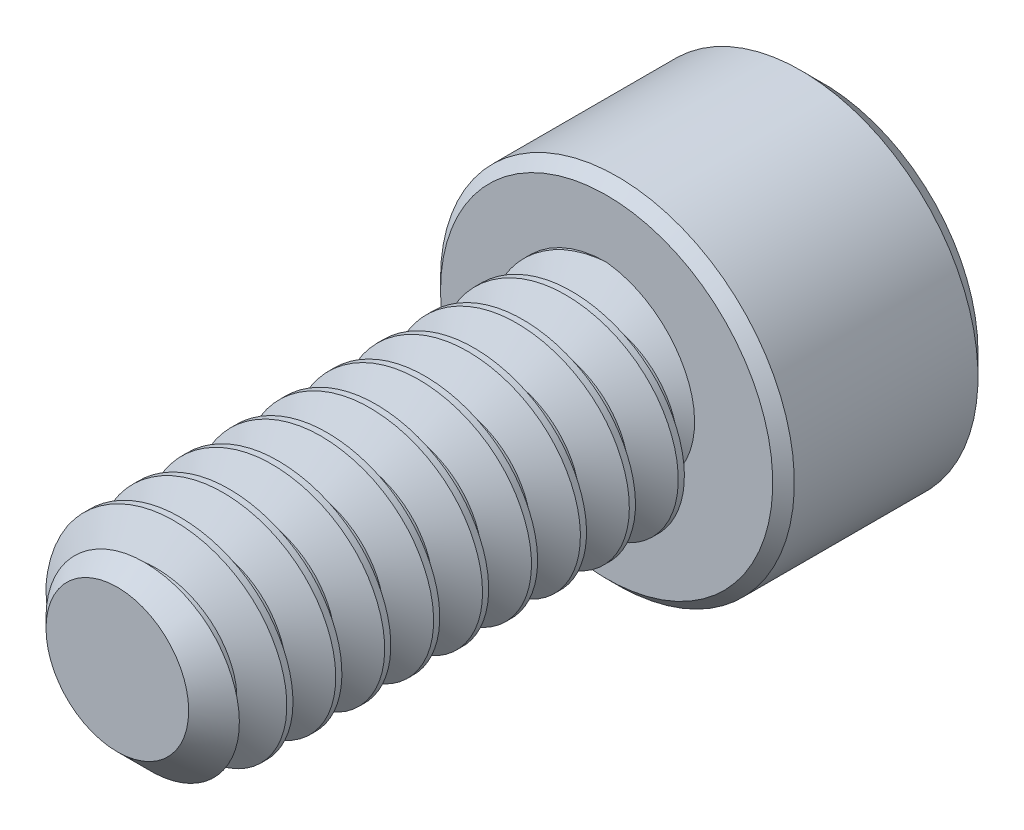
from build123d import *

# Parameters (mm, degrees)
SKETCH1_R          = 1.7526
EXTRUDE1_DEPTH     = 7.9375
CHAMFER3_SIZE      = 0.5953125
CUT_SWEEP1_PITCH   = 0.79375
SKETCH6_R          = 2.8702
EXTRUDE2_DEPTH     = 3.5052
CUT_EXTRUDE1_DEPTH = 2.08359375
SKETCH8_R          = 1.603951217
CUT_EXTRUDE2_DEPTH = 0.35052
CUT_EXTRUDE2_DRAFT = -45
CHAMFER1_SIZE      = 0.35052
CHAMFER2_SIZE      = 0.17526


with BuildPart() as part:
    # Sketch1 → Extrude1 (new body)
    with BuildSketch(Plane.XY):
        Circle(SKETCH1_R)
    extrude(amount=-EXTRUDE1_DEPTH)

    # Chamfer3
    chamfer3_edges = [part.edges().sort_by_distance(p)[0] for p in [
        (-1.7526, 0, 0),
    ]]
    chamfer(chamfer3_edges, length=CHAMFER3_SIZE)

    # Cut-Sweep1: the profile of Sketch3 profile screwed along a right-hand helix of 11 turns, 6 arcs to a turn; built about Z, then put on its axis
    cut_sweep1_z = Axis((0, 0, 0), (0, 0, 1))
    cut_sweep1_corners = [(1.7529, 0, -0.694704455), (1.237044252, 0, -0.396875), (1.237044252, 0, -0.29765625), (1.7529, 0, 0.000173205)]
    with BuildLine(mode=Mode.PRIVATE) as cut_sweep1_profile:
        Line(cut_sweep1_corners[0], cut_sweep1_corners[1])
        Line(cut_sweep1_corners[1], cut_sweep1_corners[2])
        Line(cut_sweep1_corners[2], cut_sweep1_corners[3])
        Line(cut_sweep1_corners[3], cut_sweep1_corners[0])
    cut_sweep1_cap = Face(cut_sweep1_profile.wire())
    cut_sweep1_turn_angles = [0, 30, 60, 90, 120, 150, 180, 210, 240, 270, 300, 330, 360]
    cut_sweep1_turn_weights = [1, 0.8660254037844387, 1, 0.8660254037844387, 1, 0.8660254037844387, 1, 0.8660254037844387, 1, 0.8660254037844387, 1, 0.8660254037844387, 1]
    cut_sweep1_turn_rails = [Edge.make_bspline([Vector(p[0], p[1], 0).rotate(cut_sweep1_z, cut_sweep1_turn_angles[k]) / cut_sweep1_turn_weights[k] + Vector(0, 0, p[2] + CUT_SWEEP1_PITCH * cut_sweep1_turn_angles[k] / 360) for k in range(13)], [0, 0, 0, 1, 1, 2, 2, 3, 3, 4, 4, 5, 5, 6, 6, 6], 2, cut_sweep1_turn_weights) for p in cut_sweep1_corners]
    cut_sweep1_turn_sides = [Face.make_surface_from_curves(cut_sweep1_turn_rails[p[0]], cut_sweep1_turn_rails[p[1]]) for p in [(0, 1), (1, 2), (2, 3), (3, 0)]]
    cut_sweep1 = Plane(origin=(0, 0, 0), x_dir=(0, 1, 0), z_dir=(0, 0, -1)) * Solid(Shell([*[p.moved(Location((0, 0, CUT_SWEEP1_PITCH * i))) for i in range(11) for p in cut_sweep1_turn_sides], cut_sweep1_cap, cut_sweep1_cap.rotate(cut_sweep1_z, 3960).moved(Location((0, 0, CUT_SWEEP1_PITCH * 3960 / 360)))]))
    add(cut_sweep1, mode=Mode.SUBTRACT)

    # Sketch6 → Extrude2 (add)
    with BuildSketch(Plane(origin=(0, 0, -7.9375), x_dir=(-1, 0, 0), z_dir=(0, 0, -1))):
        Circle(SKETCH6_R)
    extrude(amount=EXTRUDE2_DEPTH)

    # Sketch7 → Cut-Extrude1 (cut)
    with BuildSketch(Plane(origin=(0, 0, -11.4427), x_dir=(-1, 0, 0), z_dir=(0, 0, -1))):
        Polygon((0, 1.603951217), (-1.3890625, 0.801975608), (-1.3890625, -0.801975608), (0, -1.603951217), (1.3890625, -0.801975608), (1.3890625, 0.801975608), align=None)
    extrude(amount=-CUT_EXTRUDE1_DEPTH, mode=Mode.SUBTRACT)


with BuildPart() as cut_extrude2_tool:
    # Sketch8 → Cut-Extrude2 (with draft: the straight prism first)
    with BuildSketch(Plane(origin=(0, 0, -11.4427), x_dir=(-1, 0, 0), z_dir=(0, 0, -1))):
        Circle(SKETCH8_R)
    extrude(amount=-CUT_EXTRUDE2_DEPTH)
    # Cut-Extrude2: the draft: its side faces are tilted about the plane it starts from
    cut_extrude2_sides = [cut_extrude2_tool.faces().sort_by_distance(p)[0] for p in [
        (1.603951217, 0, -11.26744),
    ]]
    draft(cut_extrude2_sides, Plane(origin=(0, 0, -11.4427), x_dir=(-1, 0, 0), z_dir=(0, 0, -1)), CUT_EXTRUDE2_DRAFT)


with BuildPart() as part_1:
    add(part.part)

    # Cut-Extrude2: cut by cut_extrude2_tool
    add(cut_extrude2_tool.part, mode=Mode.SUBTRACT)

    # Chamfer1
    chamfer1_edges = [part_1.edges().sort_by_distance(p)[0] for p in [
        (2.8702, 0, -11.4427),
    ]]
    chamfer(chamfer1_edges, length=CHAMFER1_SIZE)

    # Chamfer2
    chamfer2_edges = [part_1.edges().sort_by_distance(p)[0] for p in [
        (2.8702, 0, -7.9375),
    ]]
    chamfer(chamfer2_edges, length=CHAMFER2_SIZE)


solid = part_1.part
